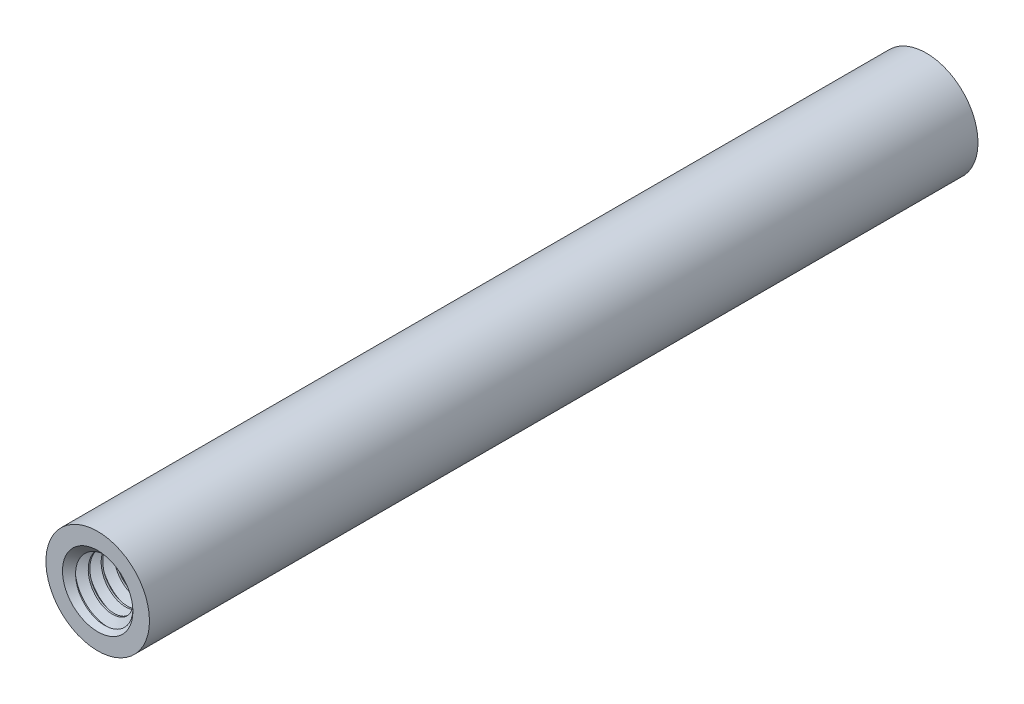
from build123d import *

# Parameters (mm, degrees)
BOSS_EXTRUDE1_START = 25.4
SKETCH13_R          = 2.0828
BOSS_EXTRUDE1_DEPTH = 11.1125
CUT_SWEEP1_PITCH    = 0.79375
CIRPATTERN1_COUNT   = 2
CIRPATTERN1_ANGLE   = 180
EXTRUDE1_DEPTH      = 25.4
EXTRUDE1_DEPTH_BACK = 25.4
SKETCH1_R           = 3.175


with BuildPart() as part:
    # Sketch13 → Boss-Extrude1 (new body)
    with BuildSketch(Plane.XY.offset(BOSS_EXTRUDE1_START)):
        Circle(SKETCH13_R)
    extrude(amount=-BOSS_EXTRUDE1_DEPTH)

    # Cut-Sweep1: the profile of Sketch15 profile screwed along a right-hand helix of 15 turns, 8 arcs to a turn; built about Z, then put on its axis
    cut_sweep1_z = Axis((0, 0, 0), (0, 0, 1))
    cut_sweep1_corners = [(2.0831, 0, -0.694704455), (2.0831, 0, 0.000173205), (1.567244252, 0, -0.29765625), (1.567244252, 0, -0.396875)]
    with BuildLine(mode=Mode.PRIVATE) as cut_sweep1_profile:
        Line(cut_sweep1_corners[0], cut_sweep1_corners[1])
        Line(cut_sweep1_corners[1], cut_sweep1_corners[2])
        Line(cut_sweep1_corners[2], cut_sweep1_corners[3])
        Line(cut_sweep1_corners[3], cut_sweep1_corners[0])
    cut_sweep1_cap = Face(cut_sweep1_profile.wire())
    cut_sweep1_turn_angles = [0, 22.5, 45, 67.5, 90, 112.5, 135, 157.5, 180, 202.5, 225, 247.5, 270, 292.5, 315, 337.5, 360]
    cut_sweep1_turn_weights = [1, 0.9238795325112867, 1, 0.9238795325112867, 1, 0.9238795325112867, 1, 0.9238795325112867, 1, 0.9238795325112867, 1, 0.9238795325112867, 1, 0.9238795325112867, 1, 0.9238795325112867, 1]
    cut_sweep1_turn_rails = [Edge.make_bspline([Vector(p[0], p[1], 0).rotate(cut_sweep1_z, cut_sweep1_turn_angles[k]) / cut_sweep1_turn_weights[k] + Vector(0, 0, p[2] + CUT_SWEEP1_PITCH * cut_sweep1_turn_angles[k] / 360) for k in range(17)], [0, 0, 0, 1, 1, 2, 2, 3, 3, 4, 4, 5, 5, 6, 6, 7, 7, 8, 8, 8], 2, cut_sweep1_turn_weights) for p in cut_sweep1_corners]
    cut_sweep1_turn_sides = [Face.make_surface_from_curves(cut_sweep1_turn_rails[p[0]], cut_sweep1_turn_rails[p[1]]) for p in [(0, 1), (1, 2), (2, 3), (3, 0)]]
    cut_sweep1 = Plane(origin=(0, 0, 25.4), x_dir=(0, 1, 0), z_dir=(0, 0, -1)) * Solid(Shell([*[p.moved(Location((0, 0, CUT_SWEEP1_PITCH * i))) for i in range(15) for p in cut_sweep1_turn_sides], cut_sweep1_cap, cut_sweep1_cap.rotate(cut_sweep1_z, 5400).moved(Location((0, 0, CUT_SWEEP1_PITCH * 5400 / 360)))]))
    add(cut_sweep1, mode=Mode.SUBTRACT)

    # Boss-Extrude2 cone 1 section (through the dimple's axis) → Boss-Extrude2 (revolve)
    with BuildSketch(Plane(origin=(0, 0, 25.4), x_dir=(0, -1, 0), z_dir=(1, 0, 0))):
        Polygon((0, 0), (2.159, 0), (0, 2.159), align=None)
    revolve(axis=Axis((0, 0, 25.4), (0, 0, -1)))


with BuildPart() as cirpattern1_1:
    # CirPattern1: pattern copy
    add(part.part.rotate(Axis((0, 3.175, 0), (0, -1, 0)), 1 * CIRPATTERN1_ANGLE / (CIRPATTERN1_COUNT - 1)))


with BuildPart() as body_3:
    # Sketch1 → Extrude1 (new, two sides: drawn at the far end of the back side and taken through both)
    with BuildSketch(Plane.XY.offset(-EXTRUDE1_DEPTH_BACK)):
        Circle(SKETCH1_R)
    extrude(amount=EXTRUDE1_DEPTH + EXTRUDE1_DEPTH_BACK)

    # Combine1: cut CirPattern1_1, part
    add(cirpattern1_1.part, mode=Mode.SUBTRACT)
    add(part.part, mode=Mode.SUBTRACT)


solid = body_3.part
